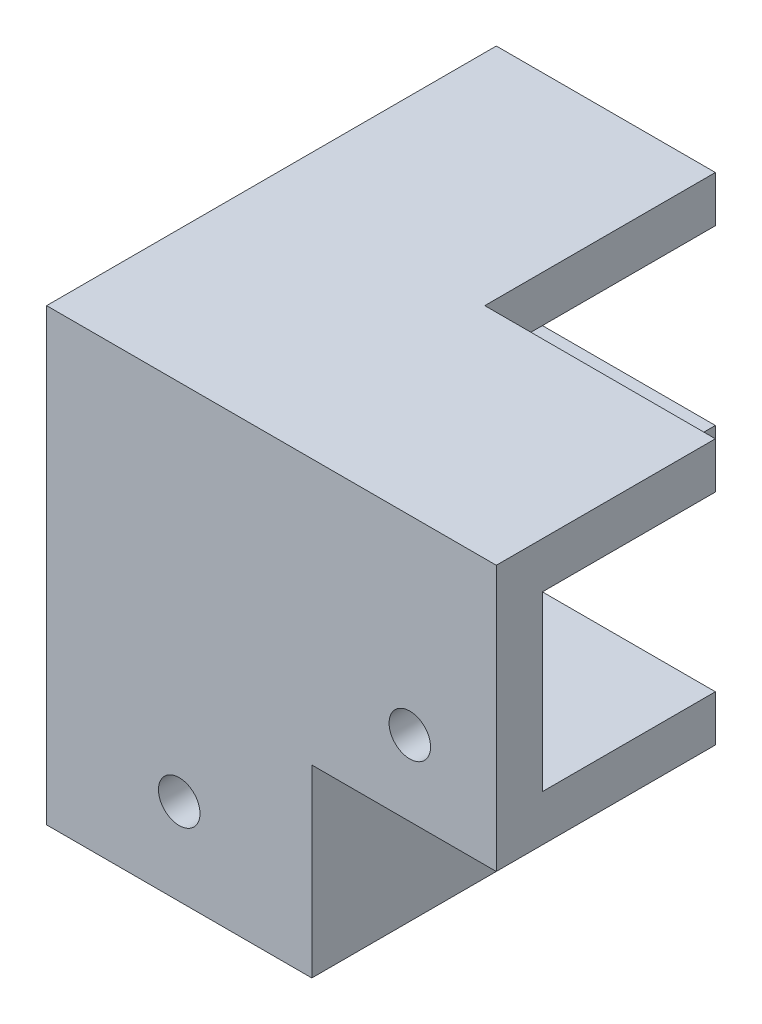
from build123d import *

# Parameters (mm, degrees)
EXTRUDE_1_DEPTH      = 20
SKETCH_2_W           = 18.9
SKETCH_2_H           = 20
EXTRUDE_2_DEPTH      = 4
EXTRUDE_3_DEPTH      = 39
SKETCH_4_W           = 19
SKETCH_4_H           = 4
EXTRUDE_4_DEPTH      = 16
EXTRUDE_5_DEPTH      = 20
EXTRUDE_5_DEPTH_BACK = 15
SKETCH_6_W           = 19
SKETCH_6_H           = 4
EXTRUDE_6_DEPTH      = 16
SKETCH_7_R           = 1.8
CUT_EXTRUDE_1_DEPTH  = 16
SKETCH_8_R           = 1.8
CUT_EXTRUDE_2_DEPTH  = 16
SKETCH_9_R           = 1.8
CUT_EXTRUDE_3_DEPTH  = 16


with BuildPart() as part:
    # 草图1 → 凸台-拉伸1 (new body)
    with BuildSketch(Plane(origin=(0, 0, 0), x_dir=(1, 0, 0), z_dir=(0, 1, 0))):
        Polygon((8.973333333, -3.090335191), (8.973333333, 0.909664809), (-6.026666667, 0.909664809), (-6.026666667, 15.909664809), (8.973333333, 15.909664809), (8.973333333, 19.909664809), (-4.573333333, 19.909664809), (-10.026666667, 19.909664809), (-10.026666667, 0.495974831), (-10.026666667, -3.090335191), align=None)
    extrude(amount=EXTRUDE_1_DEPTH)



with BuildPart() as body_2:
    # 草图2 → 凸台-拉伸2 (new body)
    with BuildSketch(Plane(origin=(8.973333333, 0, 0), x_dir=(0, 0, -1), z_dir=(1, 0, 0))):
        with Locations((6.359664809, 10)):
            Rectangle(SKETCH_2_W, SKETCH_2_H)
    extrude(amount=EXTRUDE_2_DEPTH)


with BuildPart() as part_1:
    add(part.part)

    add(body_2.part)  # 凸台-拉伸3 merges body 2
    # 草图3 → 凸台-拉伸3 (add)
    with BuildSketch(Plane.ZY.offset(10.026666667)):
        Polygon((-0.909664809, 20), (3.090335191, 20), (3.090335191, 39), (-15.909664809, 39), (-15.909664809, 35), (-0.909664809, 35), align=None)
    extrude(amount=-EXTRUDE_3_DEPTH)

    # 草图4 → 凸台-拉伸4 (add)
    with BuildSketch(Plane(origin=(12.973333333, 0, 0), x_dir=(0, 0, -1), z_dir=(1, 0, 0))):
        with Locations((6.409664809, 18)):
            Rectangle(SKETCH_4_W, SKETCH_4_H)
    extrude(amount=EXTRUDE_4_DEPTH)

    # 草图5 → 凸台-拉伸5 (add, two sides: drawn at the far end of the back side and taken through both)
    with BuildSketch(Plane(origin=(0, 0, -15.909664809), x_dir=(-1, 0, 0), z_dir=(0, 0, -1)).offset(-EXTRUDE_5_DEPTH_BACK)):
        Polygon((10.026666667, 20), (10.026666667, 39), (-8.973333333, 39), (-8.973333333, 35), (6.026666667, 35), (6.026666667, 20), align=None)
    extrude(amount=EXTRUDE_5_DEPTH + EXTRUDE_5_DEPTH_BACK)

    # 草图6 → 凸台-拉伸6 (add)
    with BuildSketch(Plane(origin=(0, 0, -19.909664809), x_dir=(-1, 0, 0), z_dir=(0, 0, -1))):
        with Locations((0.526666667, 18)):
            Rectangle(SKETCH_6_W, SKETCH_6_H)
    extrude(amount=EXTRUDE_6_DEPTH)

    # 草图7 → 切除-拉伸1 (cut)
    with BuildSketch(Plane.XY.offset(3.090335191)):
        with Locations((21.473333333, 22.5)):
            Circle(SKETCH_7_R)
    extrude(amount=-CUT_EXTRUDE_1_DEPTH, mode=Mode.SUBTRACT)

    # 草图8 → 切除-拉伸2 (cut)
    with BuildSketch(Plane.ZY.offset(10.026666667)):
        with Locations((-28.409664809, 22.5)):
            Circle(SKETCH_8_R)
        with Locations((-8.409664809, 7.5)):
            Circle(SKETCH_8_R)
    extrude(amount=-CUT_EXTRUDE_2_DEPTH, mode=Mode.SUBTRACT)

    # 草图9 → 切除-拉伸3 (cut)
    with BuildSketch(Plane.XY.offset(3.090335191)):
        with Locations((1.473333333, 7.5)):
            Circle(SKETCH_9_R)
    extrude(amount=-CUT_EXTRUDE_3_DEPTH, mode=Mode.SUBTRACT)


solid = part_1.part
